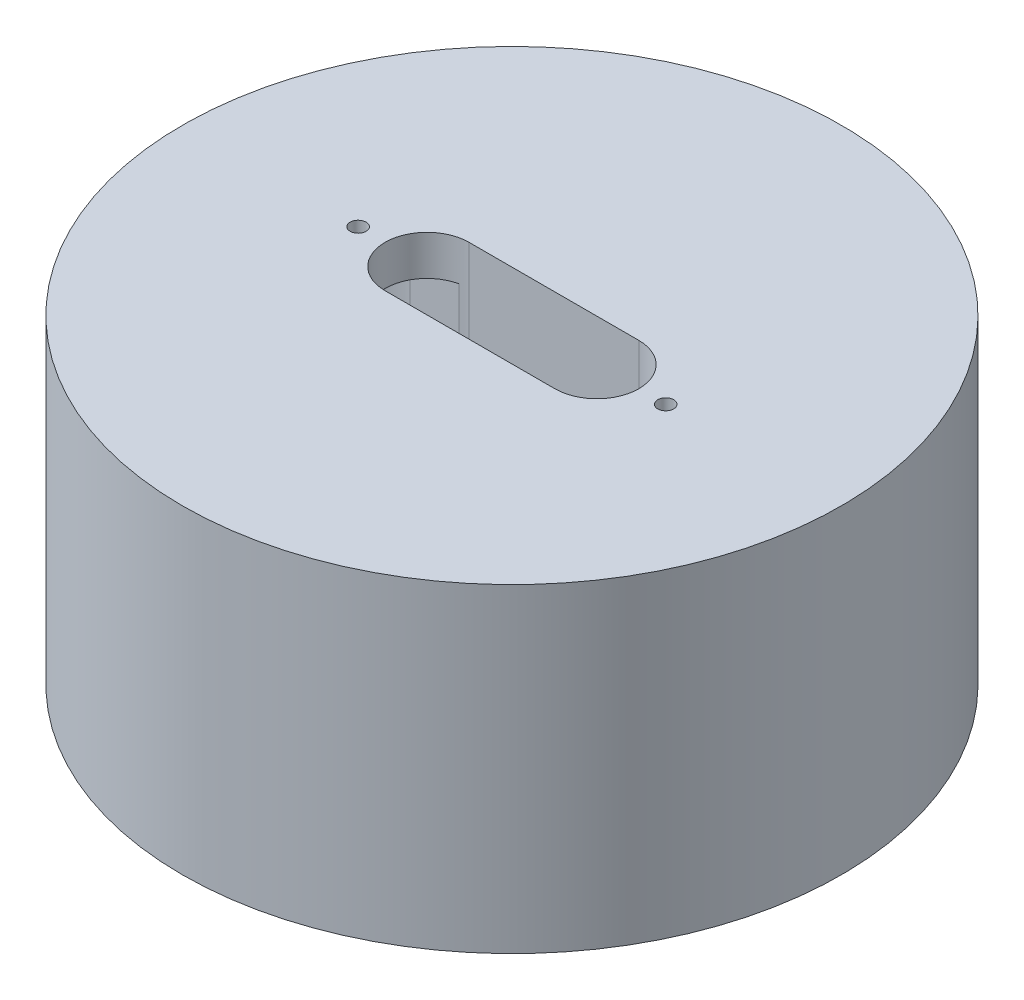
from build123d import *

# Parameters (mm, degrees)
SKETCH_1_R               = 16.5
EXTRUDE_1_DEPTH          = 16
SKETCH_2_R               = 14.25
CUT_EXTRUDE_1_DEPTH      = 5.1
SKETCH_3_R               = 9.5
CUT_EXTRUDE_2_DEPTH      = 5
CUT_EXTRUDE_3_DEPTH      = 29.293108702
CUT_EXTRUDE_START        = -14
CUT_EXTRUDE_4_DEPTH      = 3.9
SKETCH_6_R               = 0.4
CUT_EXTRUDE_5_DEPTH      = 2
SKETCH_7_R               = 0.4
CUT_EXTRUDE_6_DEPTH      = 3
PATTERN_CIRCULAR_1_COUNT = 4
CUT_EXTRUDE_START_2      = -10.1
CUT_EXTRUDE_7_DEPTH      = 10.1


# Read off the part's stored shape, not the designer's step: 切除-拉伸4
with BuildPart() as part:
    # 草图1 → 凸台-拉伸1 (new body)
    with BuildSketch(Plane(origin=(0, 0, 0), x_dir=(1, 0, 0), z_dir=(0, 1, 0))):
        with Locations(Location((0, 0, 0), (0, 0, 270))):
            Circle(SKETCH_1_R)
    extrude(amount=EXTRUDE_1_DEPTH)

    # 草图2 → 切除-拉伸1 (cut)
    with BuildSketch(Plane(origin=(0, 0, 0), x_dir=(-1, 0, 0), z_dir=(0, -1, 0))):
        with Locations(Location((0, 0, 0), (0, 0, 90))):
            Circle(SKETCH_2_R)
    extrude(amount=-CUT_EXTRUDE_1_DEPTH, mode=Mode.SUBTRACT)

    # 草图3 → 切除-拉伸2 (cut)
    with BuildSketch(Plane.XZ.offset(-5.1)):
        with Locations(Location((0, 0, 0), (0, 0, 270))):
            Circle(SKETCH_3_R)
    extrude(amount=-CUT_EXTRUDE_2_DEPTH, mode=Mode.SUBTRACT)

    # 草图4 → 切除-拉伸3 (cut, through all)
    with BuildSketch(Plane.XZ):
        with BuildLine():
            ThreePointArc((-2.15, 0), (-2.76507576, 1.48492424), (-4.25, 2.1))
            Line((-4.25, 2.1), (-4.25, -2.1))
            ThreePointArc((-4.25, -2.1), (-2.76507576, -1.48492424), (-2.15, 0))
        make_face()
        with BuildLine():
            Line((-4.25, -2.1), (-4.25, 2.1))
            ThreePointArc((-4.25, 2.1), (-6.35, 0), (-4.25, -2.1))
        make_face()
        with BuildLine():
            ThreePointArc((4.25, -2.1), (2.15, 0), (4.25, 2.1))
            Line((4.25, 2.1), (-4.25, 2.1))
            ThreePointArc((-4.25, 2.1), (-2.76507576, 1.48492424), (-2.15, 0))
            ThreePointArc((-2.15, 0), (-2.76507576, -1.48492424), (-4.25, -2.1))
            Line((-4.25, -2.1), (4.25, -2.1))
        make_face()
        with BuildLine():
            ThreePointArc((6.35, 0), (5.73492424, 1.48492424), (4.25, 2.1))
            Line((4.25, 2.1), (4.25, -2.1))
            ThreePointArc((4.25, -2.1), (5.73492424, -1.48492424), (6.35, 0))
        make_face()
        with BuildLine():
            Line((4.25, -2.1), (4.25, 2.1))
            ThreePointArc((4.25, 2.1), (2.15, 0), (4.25, -2.1))
        make_face()
    extrude(amount=-CUT_EXTRUDE_3_DEPTH, mode=Mode.SUBTRACT)

    # 切除-拉伸4 outline → 切除-拉伸4 (cut)
    with BuildSketch(Plane.XZ.offset(CUT_EXTRUDE_START)):
        with BuildLine():
            ThreePointArc((7.15, -2.05), (9.2, 0), (7.15, 2.05))
            Line((7.15, 2.05), (4.705521679, 2.05))
            ThreePointArc((4.705521679, 2.05), (6.35, 0), (4.705521679, -2.05))
            Line((4.705521679, -2.05), (7.15, -2.05))
        make_face()
        with BuildLine():
            ThreePointArc((-4.705521679, -2.05), (-6.35, 0), (-4.705521679, 2.05))
            Line((-4.705521679, 2.05), (-7.15, 2.05))
            ThreePointArc((-7.15, 2.05), (-9.2, 0), (-7.15, -2.05))
            Line((-7.15, -2.05), (-4.705521679, -2.05))
        make_face()
    extrude(amount=CUT_EXTRUDE_4_DEPTH, mode=Mode.SUBTRACT)

    # 草图6 → 切除-拉伸5 (cut)
    with BuildSketch(Plane.XZ.offset(-14)):
        with Locations(Location((7.7, 0, 0), (0, 0, 270))):
            Circle(SKETCH_6_R)
        with Locations(Location((-7.7, 0, 0), (0, 0, 270))):
            Circle(SKETCH_6_R)
    extrude(amount=-CUT_EXTRUDE_5_DEPTH, mode=Mode.SUBTRACT)

    # 草图7 → 切除-拉伸6 (cut)
    with BuildSketch(Plane.XZ):
        with Locations(Location((15, 0, 0), (0, 0, 270))):
            Circle(SKETCH_7_R)
    cut_extrude_6 = extrude(amount=-CUT_EXTRUDE_6_DEPTH, mode=Mode.SUBTRACT)

    # 阵列(圆周)1: 切除-拉伸6 ×4 about axis
    pattern_circular_1_axis = Axis((0, 0, 0), (0, 1, 0))
    for i in range(1, PATTERN_CIRCULAR_1_COUNT):
        add(cut_extrude_6.rotate(pattern_circular_1_axis, i * 360 / PATTERN_CIRCULAR_1_COUNT), mode=Mode.SUBTRACT)

    # 草图8 → 切除-拉伸7 (cut)
    with BuildSketch(Plane.XZ.offset(CUT_EXTRUDE_START_2)):
        with BuildLine():
            Line((-14.03351048, 2.474486532), (0, 0))
            Line((0, 0), (-2.474486532, 14.03351048))
            ThreePointArc((-2.474486532, 14.03351048), (-10.076271632, 10.076271632), (-14.03351048, 2.474486532))
        make_face()
        with BuildLine():
            Line((-15.018318233, 2.648134709), (-14.03351048, 2.474486532))
            ThreePointArc((-14.03351048, 2.474486532), (-10.076271632, 10.076271632), (-2.474486532, 14.03351048))
            Line((-2.474486532, 14.03351048), (-2.648134709, 15.018318233))
            ThreePointArc((-2.648134709, 15.018318233), (-10.783378413, 10.783378413), (-15.018318233, 2.648134709))
        make_face()
    extrude(amount=CUT_EXTRUDE_7_DEPTH, mode=Mode.SUBTRACT)


solid = part.part
